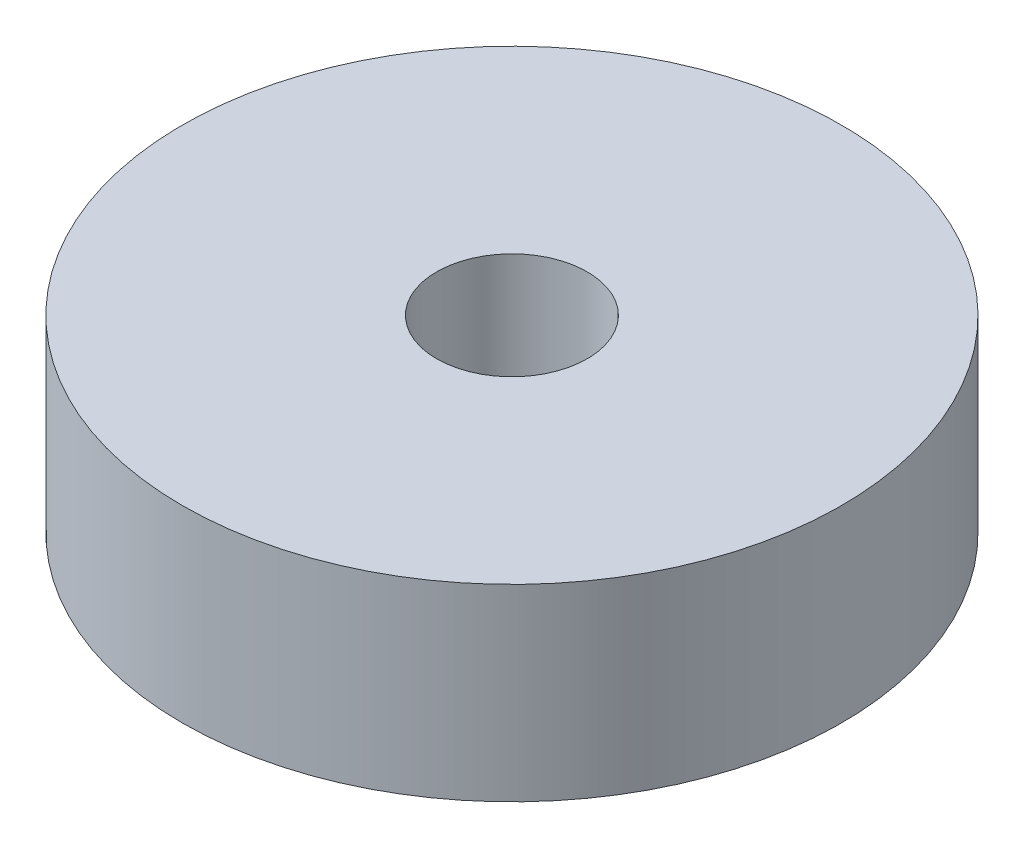
from build123d import *

# Parameters (mm, degrees)
SKETCH1_R           = 17.5
SKETCH1_R_2         = 4
BOSS_EXTRUDE1_DEPTH = 10
CUT_EXTRUDE1_DEPTH  = 7
SKETCH4_R           = 2.125
CUT_EXTRUDE2_DEPTH  = 38.818641118


with BuildPart() as part:
    # Sketch1 → Boss-Extrude1 (new body)
    with BuildSketch(Plane(origin=(0, 0, 0), x_dir=(1, 0, 0), z_dir=(0, 1, 0))):
        Circle(SKETCH1_R)
        Circle(SKETCH1_R_2, mode=Mode.SUBTRACT)
    extrude(amount=BOSS_EXTRUDE1_DEPTH)

    # Sketch3 → Cut-Extrude1 (cut)
    with BuildSketch(Plane(origin=(0, 0, 0), x_dir=(1, 0, 0), z_dir=(0, 1, 0))):
        with BuildLine():
            Line((-8.500006, 3.320491078), (-8.500006, -3.320491078))
            ThreePointArc((-8.500006, -3.320491078), (-11.5, -4.475), (-14.499994, -3.320491078))
            Line((-14.499994, -3.320491078), (-14.499994, 3.320491078))
            ThreePointArc((-14.499994, 3.320491078), (-11.5, 4.475), (-8.500006, 3.320491078))
        make_face()
    extrude(amount=CUT_EXTRUDE1_DEPTH, mode=Mode.SUBTRACT)

    # Sketch4 → Cut-Extrude2 (cut, through all)
    with BuildSketch(Plane(origin=(-14.499994, 0, 0), x_dir=(0, 0, -1), z_dir=(1, 0, 0))):
        with Locations((0, 3)):
            Circle(SKETCH4_R)
    extrude(amount=-CUT_EXTRUDE2_DEPTH, mode=Mode.SUBTRACT)


solid = part.part
